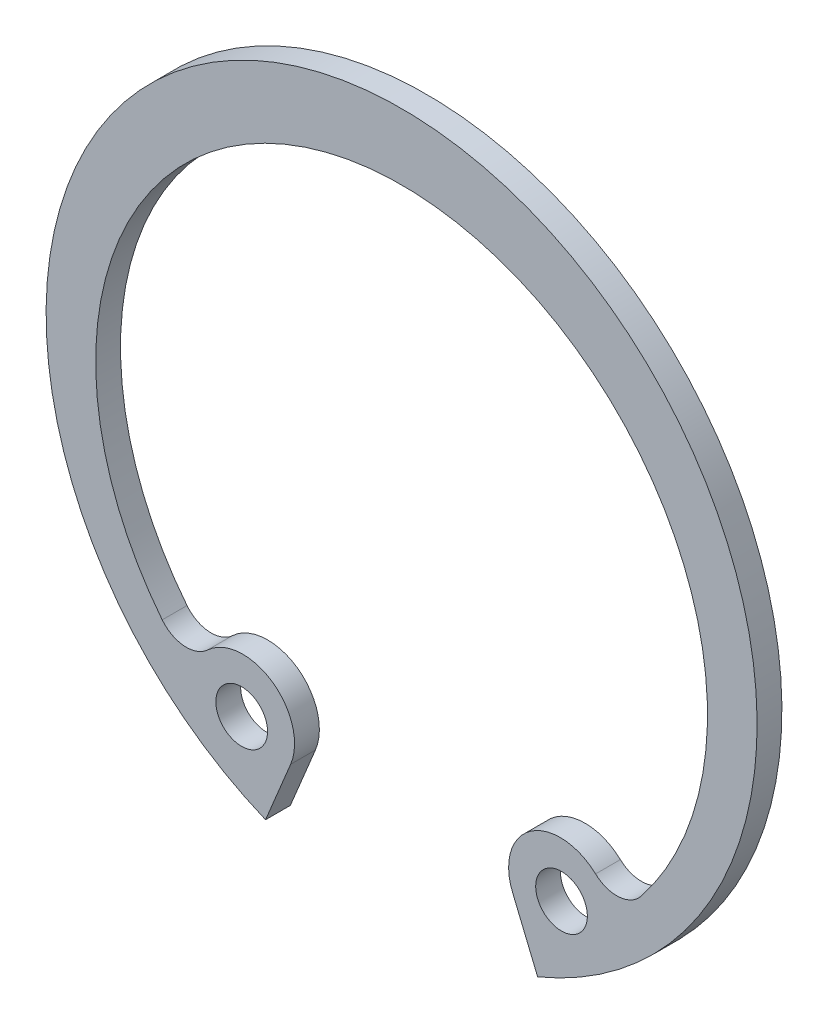
from build123d import *

# Parameters (mm, degrees)
EXTRUDE_861_DEPTH      = 0.6
EXTRUDE_861_DEPTH_BACK = 0.6
SKETCH_1_R             = 1.25


with BuildPart() as part:
    # 草图1 → Extrude 861 (new, two sides: drawn at the far end of the back side and taken through both)
    with BuildSketch(Plane.XY.offset(-EXTRUDE_861_DEPTH_BACK)):
        with BuildLine():
            Line((-5.368661222, -12.961094733), (-6.582155037, -15.890727959))
            ThreePointArc((-6.582155037, -15.890727959), (0, 17.2), (6.582155037, -15.890727959))
            Line((6.582155037, -15.890727959), (5.368661222, -12.961094733))
            ThreePointArc((5.368661222, -12.961094733), (6.253914741, -9.949889729), (9.384328678, -10.176909463))
            ThreePointArc((9.384328678, -10.176909463), (10.518604236, -10.576333458), (11.581734272, -10.014305793))
            ThreePointArc((11.581734272, -10.014305793), (0, 14), (-11.581734272, -10.014305793))
            ThreePointArc((-11.581734272, -10.014305793), (-10.518604236, -10.576333458), (-9.384328678, -10.176909463))
            ThreePointArc((-9.384328678, -10.176909463), (-6.253914741, -9.949889729), (-5.368661222, -12.961094733))
        make_face()
        with Locations((-7.736657244, -12.145128022)):
            Circle(SKETCH_1_R, mode=Mode.SUBTRACT)
        with Locations((7.736657244, -12.145128022)):
            Circle(SKETCH_1_R, mode=Mode.SUBTRACT)
    extrude(amount=EXTRUDE_861_DEPTH + EXTRUDE_861_DEPTH_BACK)


solid = part.part
